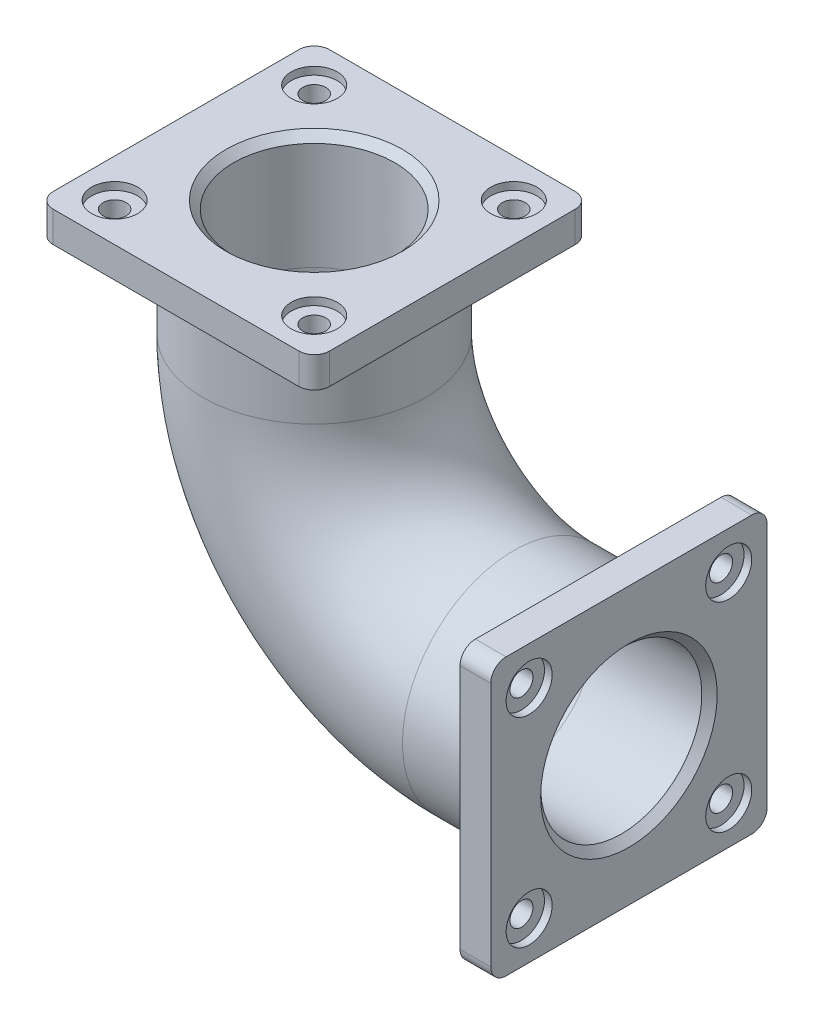
from build123d import *

# Parameters (mm, degrees)
SKETCH2_R           = 145
SKETCH2_R_2         = 105
BOSS_EXTRUDE1_START = -40
SKETCH3_W           = 360
SKETCH3_H           = 360
SKETCH3_R           = 145
BOSS_EXTRUDE1_DEPTH = 40
SKETCH4_W           = 360
SKETCH4_H           = 360
SKETCH4_R           = 145
BOSS_EXTRUDE2_DEPTH = 40
FILLET1_R           = 20
CHAMFER1_SIZE       = 10
SKETCH5_R           = 30
CUT_EXTRUDE1_DEPTH  = 10
CUT_EXTRUDE2_REACH  = 734.735
SKETCH6_R           = 15
CIRPATTERN1_COUNT   = 4
SKETCH7_R           = 30
CUT_EXTRUDE3_DEPTH  = 10
CUT_EXTRUDE4_REACH  = 848.699
SKETCH8_R           = 15
CIRPATTERN2_COUNT   = 4


with BuildPart() as part:
    # Sweep-Thin1: sweep along a path in Sketch1
    with BuildLine(Plane.XY) as sweep_thin1_path:
        Line((0, 0), (-150, 0))
        ThreePointArc((-150, 0), (-333.847763109, 76.152236891), (-410, 260))
        Line((-410, 260), (-410, 410))
    # Sketch2 → Sweep-Thin1 (sweep)
    with BuildSketch(Plane(origin=(0, 0, 0), x_dir=(0, 0, -1), z_dir=(1, 0, 0))):
        Circle(SKETCH2_R)
        Circle(SKETCH2_R_2, mode=Mode.SUBTRACT)
    sweep(path=sweep_thin1_path.line)

    # Sketch3 → Boss-Extrude1 (add)
    with BuildSketch(Plane(origin=(0, 0, 0), x_dir=(0, 0, -1), z_dir=(1, 0, 0)).offset(BOSS_EXTRUDE1_START)):
        Rectangle(SKETCH3_W, SKETCH3_H)
        Circle(SKETCH3_R, mode=Mode.SUBTRACT)
    extrude(amount=BOSS_EXTRUDE1_DEPTH)

    # Sketch4 → Boss-Extrude2 (add)
    with BuildSketch(Plane(origin=(0, 410, 0), x_dir=(1, 0, 0), z_dir=(0, 1, 0))):
        with Locations((-410, 0)):
            Rectangle(SKETCH4_W, SKETCH4_H)
        with Locations((-410, 0)):
            Circle(SKETCH4_R, mode=Mode.SUBTRACT)
    extrude(amount=-BOSS_EXTRUDE2_DEPTH)

    # Fillet1
    fillet1_edges = [part.edges().sort_by_distance(p)[0] for p in [
        (-230, 390, -180),
        (-590, 390, -180),
        (-590, 390, 180),
        (-230, 390, 180),
        (-20, 180, -180),
        (-20, -180, 180),
        (-20, -180, -180),
        (-20, 180, 180),
    ]]
    fillet(fillet1_edges, radius=FILLET1_R)

    # Chamfer1
    chamfer1_edges = [part.edges().sort_by_distance(p)[0] for p in [
        (0, 0, 105),
        (-410, 410, 105),
    ]]
    chamfer(chamfer1_edges, length=CHAMFER1_SIZE)

    # Sketch5 → Cut-Extrude1 (cut)
    with BuildSketch(Plane(origin=(0, 0, 0), x_dir=(0, 0, -1), z_dir=(1, 0, 0))):
        with Locations((-130, 130)):
            Circle(SKETCH5_R)
    cut_extrude1 = extrude(amount=-CUT_EXTRUDE1_DEPTH, mode=Mode.SUBTRACT)

    # Sketch6 → Cut-Extrude2 (cut, up to next)
    with BuildSketch(Plane(origin=(-10, 0, 0), x_dir=(0, 0, -1), z_dir=(1, 0, 0)), mode=Mode.PRIVATE) as cut_extrude2_sk1:
        with Locations((-130, 130)):
            Circle(SKETCH6_R)
    cut_extrude2_tool1 = extrude(cut_extrude2_sk1.sketch, amount=-CUT_EXTRUDE2_REACH, mode=Mode.PRIVATE) & part.part
    cut_extrude2 = cut_extrude2_tool1.solids().sort_by_distance((-10, 130, 130))[0]
    add(cut_extrude2, mode=Mode.SUBTRACT)

    # CirPattern1: Cut-Extrude1, Cut-Extrude2 ×4 about axis
    cirpattern1_axis = Axis((-10, 0, 0), (1, 0, 0))
    add([cut_extrude1.rotate(cirpattern1_axis, i * 360 / CIRPATTERN1_COUNT) for i in range(1, CIRPATTERN1_COUNT)], mode=Mode.SUBTRACT)
    add([cut_extrude2.rotate(cirpattern1_axis, i * 360 / CIRPATTERN1_COUNT) for i in range(1, CIRPATTERN1_COUNT)], mode=Mode.SUBTRACT)

    # Sketch7 → Cut-Extrude3 (cut)
    with BuildSketch(Plane(origin=(0, 410, 0), x_dir=(1, 0, 0), z_dir=(0, 1, 0))):
        with Locations((-540, 130)):
            Circle(SKETCH7_R)
    cut_extrude3 = extrude(amount=-CUT_EXTRUDE3_DEPTH, mode=Mode.SUBTRACT)

    # Sketch8 → Cut-Extrude4 (cut, up to next)
    with BuildSketch(Plane(origin=(0, 400, 0), x_dir=(1, 0, 0), z_dir=(0, 1, 0)), mode=Mode.PRIVATE) as cut_extrude4_sk1:
        with Locations((-540, 130)):
            Circle(SKETCH8_R)
    cut_extrude4_tool1 = extrude(cut_extrude4_sk1.sketch, amount=-CUT_EXTRUDE4_REACH, mode=Mode.PRIVATE) & part.part
    cut_extrude4 = cut_extrude4_tool1.solids().sort_by_distance((-540, 400, -130))[0]
    add(cut_extrude4, mode=Mode.SUBTRACT)

    # CirPattern2: Cut-Extrude3, Cut-Extrude4 ×4 about axis
    cirpattern2_axis = Axis((-410, 410, 0), (0, -1, 0))
    add([cut_extrude3.rotate(cirpattern2_axis, i * 360 / CIRPATTERN2_COUNT) for i in range(1, CIRPATTERN2_COUNT)], mode=Mode.SUBTRACT)
    add([cut_extrude4.rotate(cirpattern2_axis, i * 360 / CIRPATTERN2_COUNT) for i in range(1, CIRPATTERN2_COUNT)], mode=Mode.SUBTRACT)


solid = part.part
